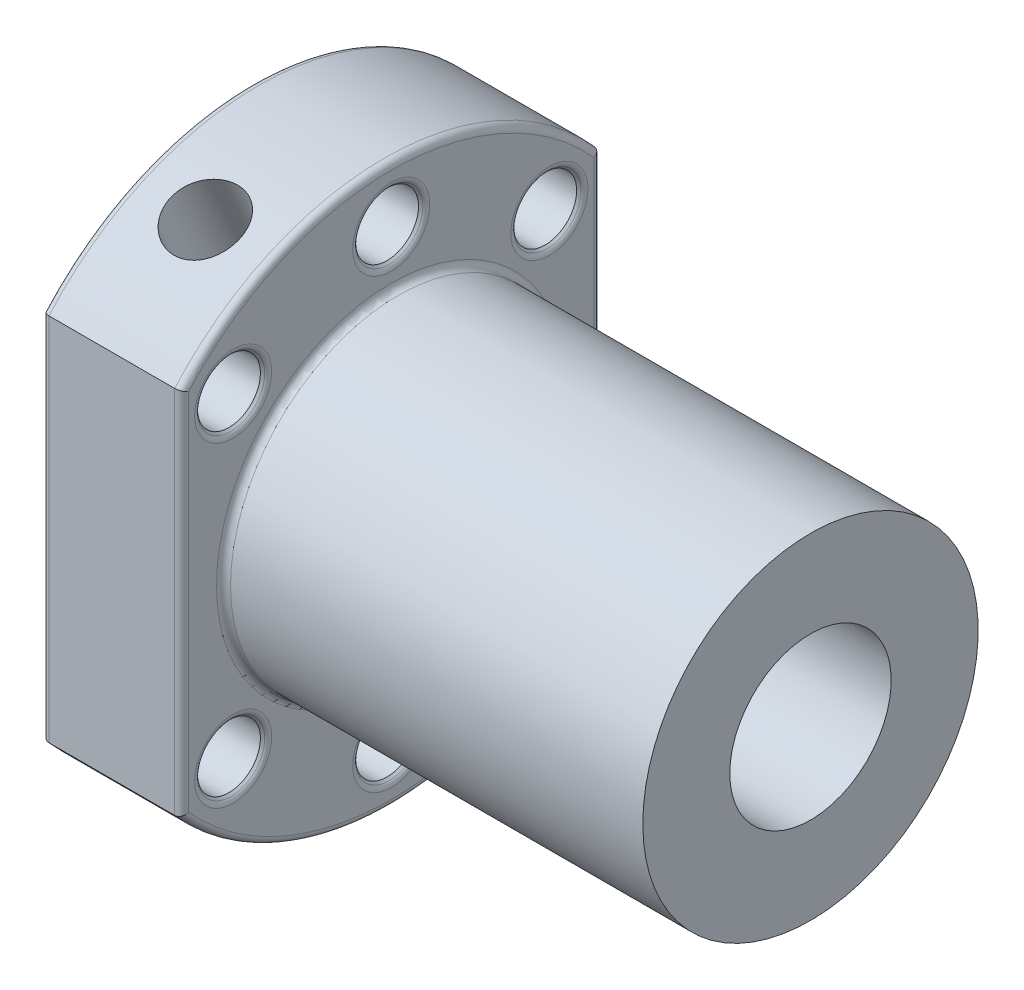
from build123d import *

# Parameters (mm, degrees)
CUT_EXTRUDE1_START = -10
CUT_EXTRUDE1_DEPTH = 10
SKETCH3_R          = 2.25
CUT_EXTRUDE2_DEPTH = 20
M6X1_01_REACH      = 58.809
M6X1_01_BORE_R     = 2.5
CHAMFER1_SIZE      = 0.3
FILLET1_R          = 0.5
FILLET2_R          = 0.5
FILLET3_R          = 0.5


# Read off the part's stored shape, not the designer's step: Cut-Extrude1
with BuildPart() as part:
    # Sketch1 → Revolve1 (revolve)
    with BuildSketch(Plane.XY, mode=Mode.PRIVATE) as revolve1_sk:
        Polygon((0, 5.775), (40, 5.775), (40, 12), (10, 12), (10, 20), (0, 20), align=None)
    revolve(revolve1_sk.sketch.rotate(Axis((0, 0, 0), (1, 0, 0)), 90), axis=Axis((0, 0, 0), (1, 0, 0)))

    # Cut-Extrude1 outline → Cut-Extrude1 (cut)
    with BuildSketch(Plane.ZY.offset(CUT_EXTRUDE1_START)):
        with BuildLine():
            Line((15, 13.228756555), (15, -13.228756555))
            ThreePointArc((15, -13.228756555), (20, 0), (15, 13.228756555))
        make_face()
        with BuildLine():
            ThreePointArc((-15, 13.228756555), (-20, 0), (-15, -13.228756555))
            Line((-15, -13.228756555), (-15, 13.228756555))
        make_face()
    extrude(amount=CUT_EXTRUDE1_DEPTH, mode=Mode.SUBTRACT)

    # Sketch3 → Cut-Extrude2 (cut)
    with BuildSketch(Plane.ZY):
        with Locations((0, 16)):
            Circle(SKETCH3_R)
        with Locations((11.313708499, 11.313708499)):
            Circle(SKETCH3_R)
        with Locations((11.313708499, -11.313708499)):
            Circle(SKETCH3_R)
        with Locations((0, -16)):
            Circle(SKETCH3_R)
        with Locations((-11.313708499, -11.313708499)):
            Circle(SKETCH3_R)
        with Locations((-11.313708499, 11.313708499)):
            Circle(SKETCH3_R)
    extrude(amount=-CUT_EXTRUDE2_DEPTH, mode=Mode.SUBTRACT)

    # Отверстие обработанное метчиком M6x1.01 bore (on position points) → Отверстие обработанное метчиком M6x1.01 (cut, up to next)
    with BuildSketch(Plane(origin=(5, 18.180820892, 8.334131729), x_dir=(0, -0.416706586463, 0.909041044617), z_dir=(0, 0.909041044617, 0.416706586463)), mode=Mode.PRIVATE) as m6x1_01_sk1:
        Circle(M6X1_01_BORE_R)
    m6x1_01_tool1 = extrude(m6x1_01_sk1.sketch, amount=-M6X1_01_REACH, mode=Mode.PRIVATE) & part.part
    add(m6x1_01_tool1.solids().sort_by_distance((5, 18.180821, 8.334132))[0], mode=Mode.SUBTRACT)

    # Chamfer1
    chamfer1_edges = [part.edges().sort_by_distance(p)[0] for p in [
        (10, 16, -2.25),
        (0, 16, -2.25),
        (10, 11.313708499, 9.063708499),
        (0, 11.313708499, 9.063708499),
        (10, -11.313708499, 9.063708499),
        (0, -11.313708499, 9.063708499),
        (10, -16, -2.25),
        (0, -16, -2.25),
        (10, -11.313708499, -13.563708499),
        (0, -11.313708499, -13.563708499),
        (10, 11.313708499, -13.563708499),
        (0, 11.313708499, -13.563708499),
    ]]
    chamfer(chamfer1_edges, length=CHAMFER1_SIZE)

    # Fillet1
    fillet1_edges = [part.edges().sort_by_distance(p)[0] for p in [
        (0, 0, -5.775),
    ]]
    fillet(fillet1_edges, radius=FILLET1_R)

    # Fillet2
    fillet2_edges = [part.edges().sort_by_distance(p)[0] for p in [
        (0, -20, 0),
        (0, 0, -15),
        (0, 0, 15),
        (0, 20, 0),
        (0, -11.313708499, -13.863708499),
        (0, 11.313708499, -13.863708499),
        (0, 16, -2.55),
        (0, 11.313708499, 8.763708499),
        (0, -16, -2.55),
        (0, -11.313708499, 8.763708499),
    ]]
    fillet(fillet2_edges, radius=FILLET2_R)

    # Fillet3
    fillet3_edges = [part.edges().sort_by_distance(p)[0] for p in [
        (10, -20, 0),
        (10, 0, -15),
        (10, 0, 15),
        (10, 20, 0),
        (10, 0, -12),
        (10, 11.313708499, 8.763708499),
        (10, 16, -2.55),
        (10, 11.313708499, -13.863708499),
        (10, -11.313708499, -13.863708499),
        (10, -16, -2.55),
        (10, -11.313708499, 8.763708499),
    ]]
    fillet(fillet3_edges, radius=FILLET3_R)


solid = part.part
